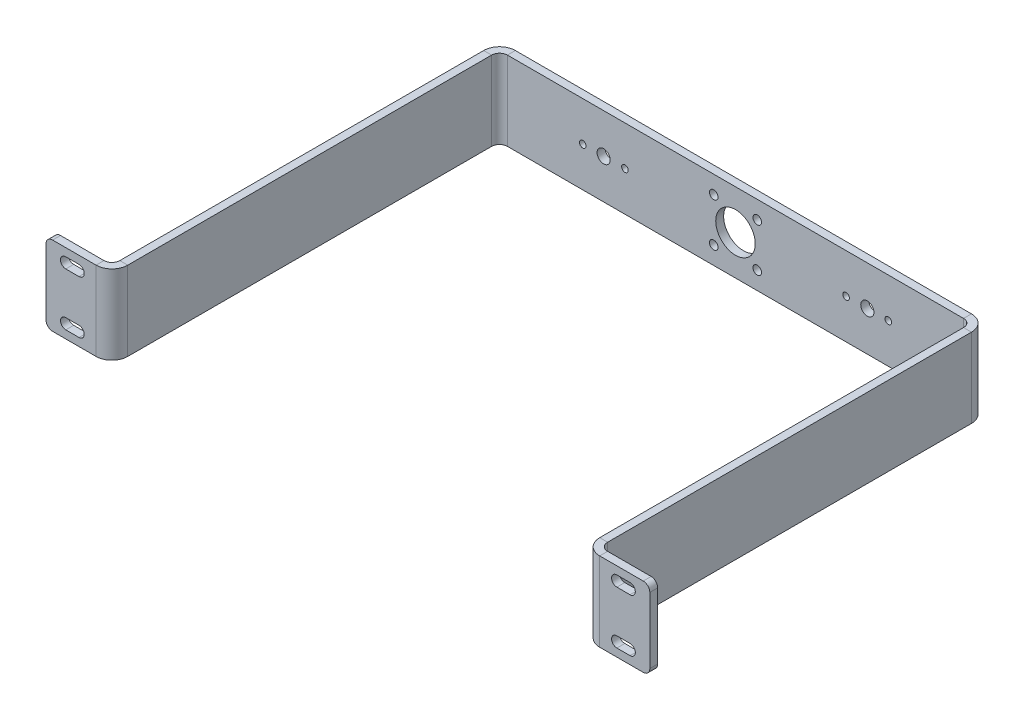
from build123d import *

# Parameters (mm, degrees)
SKETCH1_W                    = 370
SKETCH1_H                    = 60
BASE_FLANGE1_DEPTH           = 6
EDGE_FLANGE1_STRIP_W         = 36
EDGE_FLANGE1_STRIP_H         = 6
EDGE_FLANGE1_STRIP_CUT_DEPTH = 60
EDGE_FLANGE1_DEPTH           = 60
EDGE_FLANGE2_STRIP_W         = 36
EDGE_FLANGE2_STRIP_H         = 6
EDGE_FLANGE2_STRIP_CUT_DEPTH = 60
EDGE_FLANGE2_DEPTH           = 60
EDGE_FLANGE3_STRIP_W         = 36
EDGE_FLANGE3_STRIP_H         = 6
EDGE_FLANGE3_STRIP_CUT_DEPTH = 60
EDGE_FLANGE3_DEPTH           = 60
EDGE_FLANGE4_STRIP_W         = 36
EDGE_FLANGE4_STRIP_H         = 6
EDGE_FLANGE4_STRIP_CUT_DEPTH = 60
EDGE_FLANGE4_DEPTH           = 60
SKETCH18_R                   = 15
SKETCH18_R_2                 = 5
SKETCH18_R_3                 = 3.25
CUT_EXTRUDE1_DEPTH           = 65
CUT_EXTRUDE2_DEPTH           = 65
SKETCH23_R                   = 2.5
CUT_EXTRUDE3_DEPTH           = 6
FILLET1_R                    = 5


# Sheet-metal steps are written as plain solids
with BuildPart() as part:
    # Sketch1 → Base-Flange1 (new body)
    with BuildSketch(Plane.XY):
        Rectangle(SKETCH1_W, SKETCH1_H)
    extrude(amount=-BASE_FLANGE1_DEPTH)

    # Edge-Flange1 strip (across the edge) → Edge-Flange1 strip cut (cut)
    with BuildSketch(Plane(origin=(185, -30, 0), x_dir=(-1, 0, 0), z_dir=(0, 1, 0))):
        with Locations((-6, -3)):
            Rectangle(EDGE_FLANGE1_STRIP_W, EDGE_FLANGE1_STRIP_H)
    extrude(amount=EDGE_FLANGE1_STRIP_CUT_DEPTH, mode=Mode.SUBTRACT)

    # Edge-Flange1 section (across the edge) → Edge-Flange1 (add)
    with BuildSketch(Plane(origin=(185, -30, 0), x_dir=(-1, 0, 0), z_dir=(0, 1, 0))):
        with BuildLine():
            Line((0, 6), (0, 294))
            Line((0, 294), (6, 294))
            Line((6, 294), (6, 6))
            ThreePointArc((6, 6), (7.757359313, 1.757359313), (12, 0))
            Line((12, 0), (12, -6))
            ThreePointArc((12, -6), (3.514718626, -2.485281374), (0, 6))
        make_face()
    extrude(amount=EDGE_FLANGE1_DEPTH)

    # Edge-Flange2 strip (across the edge) → Edge-Flange2 strip cut (cut)
    with BuildSketch(Plane(origin=(-185, 30, 0), x_dir=(1, 0, 0), z_dir=(0, -1, 0))):
        with Locations((-6, -3)):
            Rectangle(EDGE_FLANGE2_STRIP_W, EDGE_FLANGE2_STRIP_H)
    extrude(amount=EDGE_FLANGE2_STRIP_CUT_DEPTH, mode=Mode.SUBTRACT)

    # Edge-Flange2 section (across the edge) → Edge-Flange2 (add)
    with BuildSketch(Plane(origin=(-185, 30, 0), x_dir=(1, 0, 0), z_dir=(0, -1, 0))):
        with BuildLine():
            Line((0, 6), (0, 294))
            Line((0, 294), (6, 294))
            Line((6, 294), (6, 6))
            ThreePointArc((6, 6), (7.757359313, 1.757359313), (12, 0))
            Line((12, 0), (12, -6))
            ThreePointArc((12, -6), (3.514718626, -2.485281374), (0, 6))
        make_face()
    extrude(amount=EDGE_FLANGE2_DEPTH)

    # Edge-Flange3 strip (across the edge) → Edge-Flange3 strip cut (cut)
    with BuildSketch(Plane(origin=(185, 30, 294), x_dir=(0, 0, -1), z_dir=(0, -1, 0))):
        with Locations((-6, -3)):
            Rectangle(EDGE_FLANGE3_STRIP_W, EDGE_FLANGE3_STRIP_H)
    extrude(amount=EDGE_FLANGE3_STRIP_CUT_DEPTH, mode=Mode.SUBTRACT)

    # Edge-Flange3 section (across the edge) → Edge-Flange3 (add)
    with BuildSketch(Plane(origin=(185, 30, 294), x_dir=(0, 0, -1), z_dir=(0, -1, 0))):
        with BuildLine():
            Line((0, 6), (0, 44))
            Line((0, 44), (6, 44))
            Line((6, 44), (6, 6))
            ThreePointArc((6, 6), (7.757359313, 1.757359313), (12, 0))
            Line((12, 0), (12, -6))
            ThreePointArc((12, -6), (3.514718626, -2.485281374), (0, 6))
        make_face()
    extrude(amount=EDGE_FLANGE3_DEPTH)

    # Edge-Flange4 strip (across the edge) → Edge-Flange4 strip cut (cut)
    with BuildSketch(Plane(origin=(-185, -30, 294), x_dir=(0, 0, -1), z_dir=(0, 1, 0))):
        with Locations((-6, -3)):
            Rectangle(EDGE_FLANGE4_STRIP_W, EDGE_FLANGE4_STRIP_H)
    extrude(amount=EDGE_FLANGE4_STRIP_CUT_DEPTH, mode=Mode.SUBTRACT)

    # Edge-Flange4 section (across the edge) → Edge-Flange4 (add)
    with BuildSketch(Plane(origin=(-185, -30, 294), x_dir=(0, 0, -1), z_dir=(0, 1, 0))):
        with BuildLine():
            Line((0, 6), (0, 44))
            Line((0, 44), (6, 44))
            Line((6, 44), (6, 6))
            ThreePointArc((6, 6), (7.757359313, 1.757359313), (12, 0))
            Line((12, 0), (12, -6))
            ThreePointArc((12, -6), (3.514718626, -2.485281374), (0, 6))
        make_face()
    extrude(amount=EDGE_FLANGE4_DEPTH)

    # Sketch18 → Cut-Extrude1 (cut)
    with BuildSketch(Plane(origin=(0, 0, -6), x_dir=(-1, 0, 0), z_dir=(0, 0, -1))):
        Circle(SKETCH18_R)
        with Locations((-100, 0)):
            Circle(SKETCH18_R_2)
        with Locations((100, 0)):
            Circle(SKETCH18_R_2)
        with Locations((-16.5, 16.5)):
            Circle(SKETCH18_R_3)
        with Locations((16.5, 16.5)):
            Circle(SKETCH18_R_3)
        with Locations((16.5, -16.5)):
            Circle(SKETCH18_R_3)
        with Locations((-16.5, -16.5)):
            Circle(SKETCH18_R_3)
    extrude(amount=-CUT_EXTRUDE1_DEPTH, mode=Mode.SUBTRACT)

    # Sketch22 → Cut-Extrude2 (cut)
    with BuildSketch(Plane(origin=(0, 0, 288), x_dir=(-1, 0, 0), z_dir=(0, 0, -1))):
        with BuildLine():
            Line((-204, 16), (-214, 16))
            ThreePointArc((-214, 16), (-218, 20), (-214, 24))
            Line((-214, 24), (-204, 24))
            ThreePointArc((-204, 24), (-200, 20), (-204, 16))
        make_face()
        with BuildLine():
            Line((-204, -16), (-214, -16))
            ThreePointArc((-214, -16), (-218, -20), (-214, -24))
            Line((-214, -24), (-204, -24))
            ThreePointArc((-204, -24), (-200, -20), (-204, -16))
        make_face()
        with BuildLine():
            Line((204, 16), (214, 16))
            ThreePointArc((214, 16), (218, 20), (214, 24))
            Line((214, 24), (204, 24))
            ThreePointArc((204, 24), (200, 20), (204, 16))
        make_face()
        with BuildLine():
            Line((204, -16), (214, -16))
            ThreePointArc((214, -16), (218, -20), (214, -24))
            Line((214, -24), (204, -24))
            ThreePointArc((204, -24), (200, -20), (204, -16))
        make_face()
    extrude(amount=-CUT_EXTRUDE2_DEPTH, mode=Mode.SUBTRACT)

    # Sketch23 → Cut-Extrude3 (cut)
    with BuildSketch(Plane(origin=(0, 0, -6), x_dir=(-1, 0, 0), z_dir=(0, 0, -1))):
        with Locations((115.875233888, 0.006238306)):
            Circle(SKETCH23_R)
        with Locations((83.875233888, 0.006238306)):
            Circle(SKETCH23_R)
        with Locations((-115.875233888, 0.006238306)):
            Circle(SKETCH23_R)
        with Locations((-83.875233888, 0.006238306)):
            Circle(SKETCH23_R)
    extrude(amount=-CUT_EXTRUDE3_DEPTH, mode=Mode.SUBTRACT)

    # Fillet1
    fillet1_edges = [part.edges().sort_by_distance(p)[0] for p in [
        (229, 30, 291),
        (229, -30, 291),
        (-229, -30, 291),
        (-229, 30, 291),
    ]]
    fillet(fillet1_edges, radius=FILLET1_R)


solid = part.part
